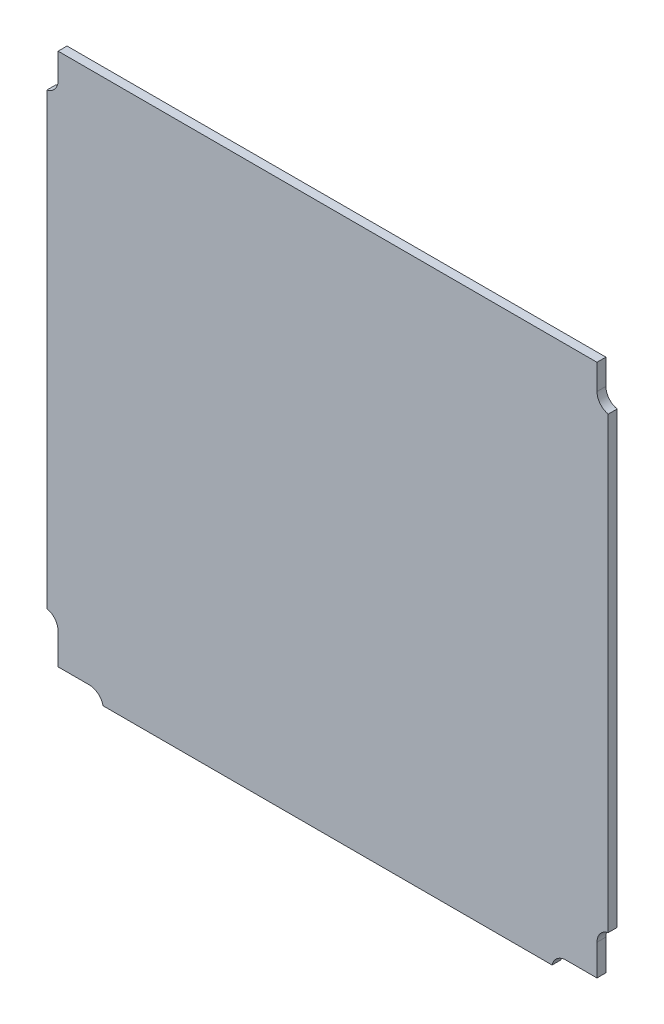
from build123d import *

# Parameters (mm, degrees)
BOSS_EXTRUDE1_DEPTH = 1.5875
FILLET1_R           = 2.54


with BuildPart() as part:
    # Sketch1 → Boss-Extrude1 (new body)
    with BuildSketch(Plane.XY):
        Polygon((-40, -48), (-40, -50), (-37.864895224, -50), (40, -50), (40, -48), (48, -48), (48, -40), (50, -40), (50, 40), (48, 40), (48, 47), (-48, 47), (-48, 40), (-50, 40), (-50, -37.864895224), (-50, -40), (-48, -40), (-48, -48), align=None)
    extrude(amount=BOSS_EXTRUDE1_DEPTH)

    # Fillet1
    # the kernel refuses this fillet: 2.54 mm, written as the material it adds along each edge
    with BuildSketch(Plane(origin=(-48, -40, 0), x_dir=(0, -1, 0), z_dir=(0, 0, 1)), Plane(origin=(48, 40, 0), x_dir=(0, 1, 0), z_dir=(0, 0, 1))) as fillet1_piece_1:
        with BuildLine():
            CenterArc((2.481934729, -2.54), FILLET1_R, 90, 77.725329785)
            Line((0, -2), (-0.049638695, -1.9892))
            ThreePointArc((-0.049638695, -1.9892), (-0.0508, -1), (-0.0508, 0))
            Line((-0.0508, 0), (0, 0.0508))
            Line((0, 0.0508), (2.481934729, 0.0508))
            Line((2.481934729, 0.0508), (2.481934729, 0))
        make_face()
    extrude(amount=1.5875)
    with BuildSketch(Plane(origin=(-40, -48, 0), x_dir=(-3.737454790095179e-12, -1.0, 0), z_dir=(0, 0, 1)), Plane(origin=(48, -40, 0), x_dir=(1.0, -3.7339020764163554e-12, 0), z_dir=(0, 0, 1)), Plane(origin=(-48, 40, 0), x_dir=(-1.0, 3.790745495277064e-12, 0), z_dir=(0, 0, 1))) as fillet1_piece_2:
        with BuildLine():
            CenterArc((2.54, -2.481934729), FILLET1_R, 102.274670215, 77.725329785)
            Line((0, -2.481934729), (-0.0508, -2.481934729))
            Line((-0.0508, -2.481934729), (-0.0508, 0))
            Line((-0.0508, 0), (0, 0.0508))
            ThreePointArc((0, 0.0508), (1, 0.0508), (1.9892, 0.049638695))
            Line((1.9892, 0.049638695), (2, 0))
        make_face()
    extrude(amount=1.5875)
    with BuildSketch(Plane(origin=(40, -48, 0), x_dir=(3.808509063671012e-12, -1.0, 0), z_dir=(0, 0, 1))) as fillet1_piece_3:
        with BuildLine():
            CenterArc((2.54, 2.481934729), FILLET1_R, 180, 77.725329785)
            Line((0, 2.481934729), (-0.0508, 2.481934729))
            Line((-0.0508, 2.481934729), (-0.0508, 0))
            Line((-0.0508, 0), (0, -0.0508))
            ThreePointArc((0, -0.0508), (1, -0.0508), (1.9892, -0.049638695))
            Line((1.9892, -0.049638695), (2, 0))
        make_face()
    extrude(amount=1.5875)


solid = part.part
